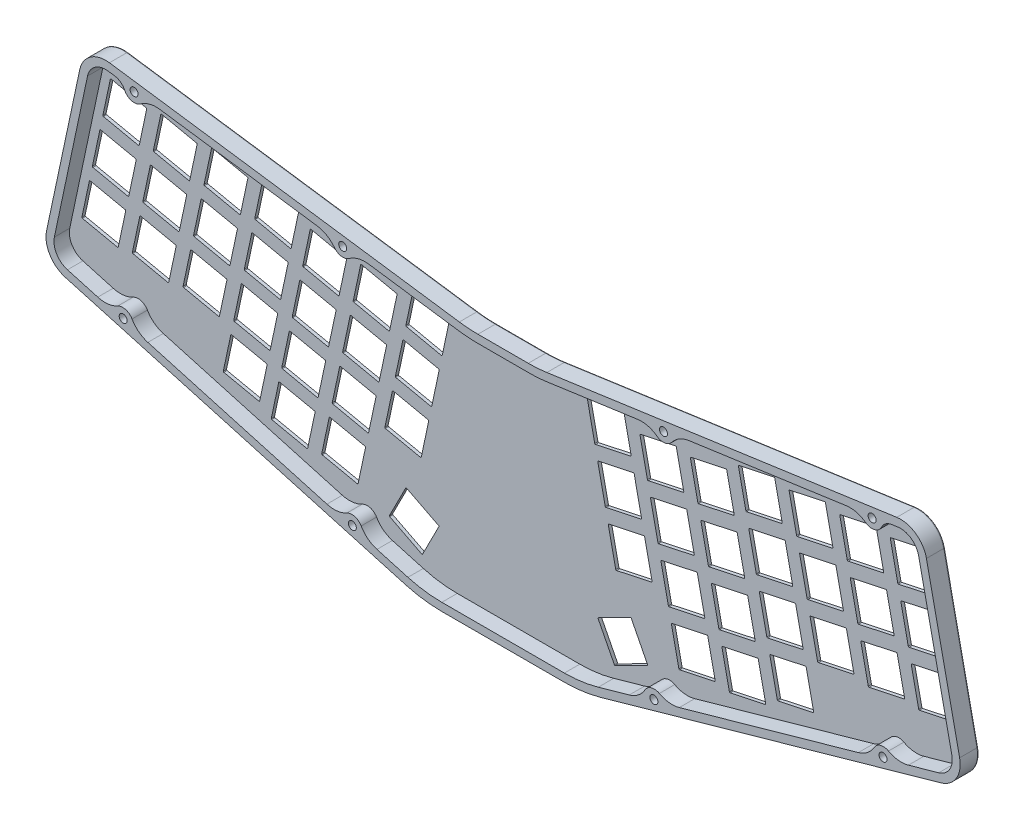
from build123d import *

# Parameters (mm, degrees)
MODEL_R             = 1.5
BOSS_EXTRUDE1_DEPTH = 7
BOSS_EXTRUDE2_DEPTH = 1.2
MODEL_4_R           = 1.5
BOSS_EXTRUDE3_DEPTH = 2
FILLET1_R           = 0.5


with BuildPart() as part:
    # Model → Boss-Extrude1 (new body)
    with BuildSketch(Plane.XY):
        with BuildLine():
            Line((332.060338107, 8.179016053), (325.312640255, 39.924438699))
            Line((325.312640255, 39.924438699), (319.565261174, 66.96373151))
            ThreePointArc((319.565261174, 66.96373151), (315.515297863, 73.079110459), (308.381777137, 74.78584552))
            Line((308.381777137, 74.78584552), (176.614039179, 56.12761726))
            ThreePointArc((176.614039179, 56.12761726), (173.117705991, 55.75738597), (169.603999044, 55.6337718))
            Line((169.603999044, 55.6337718), (150.648829756, 55.6337718))
            ThreePointArc((150.648829756, 55.6337718), (147.135122809, 55.75738597), (143.63878962, 56.12761726))
            Line((143.63878962, 56.12761726), (11.871051663, 74.785845521))
            ThreePointArc((11.871051663, 74.785845521), (4.737530938, 73.07911046), (0.687567627, 66.963731511))
            Line((0.687567627, 66.963731511), (-5.059811455, 39.924438699))
            Line((-5.059811455, 39.924438699), (-11.807509307, 8.179016053))
            ThreePointArc((-11.807509307, 8.179016053), (-10.587273101, 0.932194341), (-4.743504981, -3.523787647))
            Line((-4.743504981, -3.523787647), (47.488623446, -18.272743308))
            Line((47.488623446, -18.272743308), (123.463014033, -39.725878608))
            ThreePointArc((123.463014033, -39.725878608), (130.191863147, -41.134819356), (137.050372447, -41.6074446))
            Line((137.050372447, -41.6074446), (160.1264144, -41.6074446))
            Line((160.1264144, -41.6074446), (183.202456353, -41.6074446))
            ThreePointArc((183.202456353, -41.6074446), (190.060965653, -41.134819356), (196.789814767, -39.725878608))
            Line((196.789814767, -39.725878608), (272.764205354, -18.272743308))
            Line((272.764205354, -18.272743308), (324.996333781, -3.523787647))
            ThreePointArc((324.996333781, -3.523787647), (330.840101901, 0.932194341), (332.060338107, 8.179016053))
        make_face()
        with Locations((103.335575354, -30.405568574)):
            Circle(MODEL_R, mode=Mode.SUBTRACT)
        with Locations((17.039281052, -6.037803815)):
            Circle(MODEL_R, mode=Mode.SUBTRACT)
        with Locations((216.917253446, -30.405568574)):
            Circle(MODEL_R, mode=Mode.SUBTRACT)
        with Locations((303.213547748, -6.037803815)):
            Circle(MODEL_R, mode=Mode.SUBTRACT)
        with Locations((21.146353911, 69.937554571)):
            Circle(MODEL_R, mode=Mode.SUBTRACT)
        with Locations((99.718342652, 58.811810716)):
            Circle(MODEL_R, mode=Mode.SUBTRACT)
        with BuildLine():
            Line((316.630818371, 66.339996441), (322.378197452, 39.30070363))
            Line((322.378197452, 39.30070363), (329.125895305, 7.555280983))
            ThreePointArc((329.125895305, 7.555280983), (328.27172996, 2.482505785), (324.181092276, -0.636681606))
            Line((324.181092276, -0.636681606), (312.778670176, -3.85642055))
            ThreePointArc((312.778670176, -3.85642055), (308.939676687, -4.169644175), (305.26707195, -3.008629753))
            ThreePointArc((305.26707195, -3.008629753), (302.26243266, -2.669513434), (299.878929754, -4.530096956))
            ThreePointArc((299.878929754, -4.530096956), (297.356002421, -7.440563881), (293.920172489, -9.18155576))
            Line((293.920172489, -9.18155576), (271.948963849, -15.385637267))
            Line((271.948963849, -15.385637267), (226.482375873, -28.224185309))
            ThreePointArc((226.482375873, -28.224185309), (222.643382385, -28.537408934), (218.970777647, -27.376394512))
            ThreePointArc((218.970777647, -27.376394512), (215.966138357, -27.037278193), (213.582635451, -28.897861715))
            ThreePointArc((213.582635451, -28.897861715), (211.059708119, -31.80832864), (207.623878187, -33.549320519))
            Line((207.623878187, -33.549320519), (195.974573262, -36.838772567))
            ThreePointArc((195.974573262, -36.838772567), (189.649455095, -38.16317687), (183.202456353, -38.6074446))
            Line((183.202456353, -38.6074446), (160.1264144, -38.6074446))
            Line((160.1264144, -38.6074446), (137.050372447, -38.6074446))
            ThreePointArc((137.050372447, -38.6074446), (130.603373705, -38.16317687), (124.278255538, -36.838772567))
            Line((124.278255538, -36.838772567), (112.628950613, -33.549320519))
            ThreePointArc((112.628950613, -33.549320519), (109.193120681, -31.80832864), (106.670193349, -28.897861715))
            ThreePointArc((106.670193349, -28.897861715), (104.286690443, -27.037278193), (101.282051153, -27.376394512))
            ThreePointArc((101.282051153, -27.376394512), (97.609446415, -28.537408934), (93.770452927, -28.224185309))
            Line((93.770452927, -28.224185309), (48.303864951, -15.385637267))
            Line((48.303864951, -15.385637267), (26.332656311, -9.18155576))
            ThreePointArc((26.332656311, -9.18155576), (22.896826379, -7.440563881), (20.373899046, -4.530096956))
            ThreePointArc((20.373899046, -4.530096956), (17.99039614, -2.669513434), (14.98575685, -3.008629753))
            ThreePointArc((14.98575685, -3.008629753), (11.313152113, -4.169644175), (7.474158624, -3.85642055))
            Line((7.474158624, -3.85642055), (-3.928263476, -0.636681606))
            ThreePointArc((-3.928263476, -0.636681606), (-8.01890116, 2.482505785), (-8.873066505, 7.555280983))
            Line((-8.873066505, 7.555280983), (-2.125368652, 39.30070363))
            Line((-2.125368652, 39.30070363), (3.622010429, 66.339996442))
            ThreePointArc((3.622010429, 66.339996442), (6.456984747, 70.620761706), (11.450449255, 71.815476249))
            Line((11.450449255, 71.815476249), (13.807051559, 71.481782855))
            ThreePointArc((13.807051559, 71.481782855), (16.05801748, 70.566743382), (17.611829082, 68.698638909))
            ThreePointArc((17.611829082, 68.698638909), (20.250303311, 66.551050421), (23.587647853, 67.21121251))
            ThreePointArc((23.587647853, 67.21121251), (27.071325394, 68.854371308), (30.917639732, 69.058934404))
            Line((30.917639732, 69.058934404), (90.087257633, 60.680553975))
            ThreePointArc((90.087257633, 60.680553975), (93.725570339, 59.416172428), (96.616102068, 56.870429634))
            ThreePointArc((96.616102068, 56.870429634), (99.227639842, 55.346379898), (102.159636594, 56.085468655))
            ThreePointArc((102.159636594, 56.085468655), (105.643314135, 57.728627453), (109.489628473, 57.933190549))
            Line((109.489628473, 57.933190549), (143.218187212, 53.157247988))
            ThreePointArc((143.218187212, 53.157247988), (146.924300392, 52.76480282), (150.648829756, 52.6337718))
            Line((150.648829756, 52.6337718), (169.603999044, 52.6337718))
            ThreePointArc((169.603999044, 52.6337718), (173.328528408, 52.76480282), (177.034641588, 53.157247988))
            Line((177.034641588, 53.157247988), (210.763200327, 57.933190549))
            ThreePointArc((210.763200327, 57.933190549), (214.609514665, 57.728627453), (218.093192206, 56.085468655))
            ThreePointArc((218.093192206, 56.085468655), (221.025188958, 55.346379898), (223.636726732, 56.870429634))
            ThreePointArc((223.636726732, 56.870429634), (226.52725846, 59.416172428), (230.165571167, 60.680553974))
            Line((230.165571167, 60.680553974), (289.335189068, 69.058934403))
            ThreePointArc((289.335189068, 69.058934403), (293.181503406, 68.854371307), (296.665180948, 67.211212509))
            ThreePointArc((296.665180948, 67.211212509), (300.002525489, 66.55105042), (302.640999718, 68.698638908))
            ThreePointArc((302.640999718, 68.698638908), (304.19481132, 70.566743381), (306.445777241, 71.481782853))
            Line((306.445777241, 71.481782853), (308.802379545, 71.815476247))
            ThreePointArc((308.802379545, 71.815476247), (313.795844053, 70.620761705), (316.630818371, 66.339996441))
        make_face(mode=Mode.SUBTRACT)
        with Locations((220.534486148, 58.811810716)):
            Circle(MODEL_R, mode=Mode.SUBTRACT)
        with Locations((299.10647489, 69.93755457)):
            Circle(MODEL_R, mode=Mode.SUBTRACT)
    extrude(amount=BOSS_EXTRUDE1_DEPTH)

    # Model<3> → Boss-Extrude2 (add)
    with BuildSketch(Plane.XY):
        with BuildLine():
            Line((329.125895305, 7.555280983), (322.378197452, 39.30070363))
            Line((322.378197452, 39.30070363), (316.630818371, 66.339996441))
            ThreePointArc((316.630818371, 66.339996441), (313.795844053, 70.620761705), (308.802379545, 71.815476247))
            Line((308.802379545, 71.815476247), (306.445777241, 71.481782853))
            ThreePointArc((306.445777241, 71.481782853), (304.19481132, 70.566743381), (302.640999718, 68.698638908))
            ThreePointArc((302.640999718, 68.698638908), (300.002525489, 66.55105042), (296.665180948, 67.211212509))
            ThreePointArc((296.665180948, 67.211212509), (293.181503406, 68.854371307), (289.335189068, 69.058934403))
            Line((289.335189068, 69.058934403), (230.165571167, 60.680553974))
            ThreePointArc((230.165571167, 60.680553974), (226.52725846, 59.416172428), (223.636726732, 56.870429634))
            ThreePointArc((223.636726732, 56.870429634), (221.025188958, 55.346379898), (218.093192206, 56.085468655))
            ThreePointArc((218.093192206, 56.085468655), (214.609514665, 57.728627453), (210.763200327, 57.933190549))
            Line((210.763200327, 57.933190549), (177.034641588, 53.157247988))
            ThreePointArc((177.034641588, 53.157247988), (173.328528408, 52.76480282), (169.603999044, 52.6337718))
            Line((169.603999044, 52.6337718), (150.648829756, 52.6337718))
            ThreePointArc((150.648829756, 52.6337718), (146.924300392, 52.76480282), (143.218187212, 53.157247988))
            Line((143.218187212, 53.157247988), (109.489628473, 57.933190549))
            ThreePointArc((109.489628473, 57.933190549), (105.643314135, 57.728627453), (102.159636594, 56.085468655))
            ThreePointArc((102.159636594, 56.085468655), (99.227639842, 55.346379898), (96.616102068, 56.870429634))
            ThreePointArc((96.616102068, 56.870429634), (93.725570339, 59.416172428), (90.087257633, 60.680553975))
            Line((90.087257633, 60.680553975), (30.917639732, 69.058934404))
            ThreePointArc((30.917639732, 69.058934404), (27.071325394, 68.854371308), (23.587647853, 67.21121251))
            ThreePointArc((23.587647853, 67.21121251), (20.250303311, 66.551050421), (17.611829082, 68.698638909))
            ThreePointArc((17.611829082, 68.698638909), (16.05801748, 70.566743382), (13.807051559, 71.481782855))
            Line((13.807051559, 71.481782855), (11.450449255, 71.815476249))
            ThreePointArc((11.450449255, 71.815476249), (6.456984747, 70.620761706), (3.622010429, 66.339996442))
            Line((3.622010429, 66.339996442), (-2.125368652, 39.30070363))
            Line((-2.125368652, 39.30070363), (-8.873066505, 7.555280983))
            ThreePointArc((-8.873066505, 7.555280983), (-8.01890116, 2.482505785), (-3.928263476, -0.636681606))
            Line((-3.928263476, -0.636681606), (7.474158624, -3.85642055))
            ThreePointArc((7.474158624, -3.85642055), (11.313152113, -4.169644175), (14.98575685, -3.008629753))
            ThreePointArc((14.98575685, -3.008629753), (17.99039614, -2.669513434), (20.373899046, -4.530096956))
            ThreePointArc((20.373899046, -4.530096956), (22.896826379, -7.440563881), (26.332656311, -9.18155576))
            Line((26.332656311, -9.18155576), (48.303864951, -15.385637267))
            Line((48.303864951, -15.385637267), (93.770452927, -28.224185309))
            ThreePointArc((93.770452927, -28.224185309), (97.609446415, -28.537408934), (101.282051153, -27.376394512))
            ThreePointArc((101.282051153, -27.376394512), (104.286690443, -27.037278193), (106.670193349, -28.897861715))
            ThreePointArc((106.670193349, -28.897861715), (109.193120681, -31.80832864), (112.628950613, -33.549320519))
            Line((112.628950613, -33.549320519), (124.278255538, -36.838772567))
            ThreePointArc((124.278255538, -36.838772567), (130.603373705, -38.16317687), (137.050372447, -38.6074446))
            Line((137.050372447, -38.6074446), (160.1264144, -38.6074446))
            Line((160.1264144, -38.6074446), (183.202456353, -38.6074446))
            ThreePointArc((183.202456353, -38.6074446), (189.649455095, -38.16317687), (195.974573262, -36.838772567))
            Line((195.974573262, -36.838772567), (207.623878187, -33.549320519))
            ThreePointArc((207.623878187, -33.549320519), (211.059708119, -31.80832864), (213.582635451, -28.897861715))
            ThreePointArc((213.582635451, -28.897861715), (215.966138357, -27.037278193), (218.970777647, -27.376394512))
            ThreePointArc((218.970777647, -27.376394512), (222.643382385, -28.537408934), (226.482375873, -28.224185309))
            Line((226.482375873, -28.224185309), (271.948963849, -15.385637267))
            Line((271.948963849, -15.385637267), (293.920172489, -9.18155576))
            ThreePointArc((293.920172489, -9.18155576), (297.356002421, -7.440563881), (299.878929754, -4.530096956))
            ThreePointArc((299.878929754, -4.530096956), (302.26243266, -2.669513434), (305.26707195, -3.008629753))
            ThreePointArc((305.26707195, -3.008629753), (308.939676687, -4.169644175), (312.778670176, -3.85642055))
            Line((312.778670176, -3.85642055), (324.181092276, -0.636681606))
            ThreePointArc((324.181092276, -0.636681606), (328.27172996, 2.482505785), (329.125895305, 7.555280983))
        make_face()
        with BuildLine():
            ThreePointArc((86.217569965, -18.8372805), (86.059880245, -18.728903359), (86.025010987, -18.540765678))
            Line((86.025010987, -18.540765678), (88.8318188, -5.335773065))
            ThreePointArc((88.8318188, -5.335773065), (88.940195941, -5.178083345), (89.128333622, -5.143214087))
            Line((89.128333622, -5.143214087), (102.333326235, -7.9500219))
            ThreePointArc((102.333326235, -7.9500219), (102.491015955, -8.058399041), (102.525885213, -8.246536722))
            Line((102.525885213, -8.246536722), (99.7190774, -21.451529335))
            ThreePointArc((99.7190774, -21.451529335), (99.610700259, -21.609219055), (99.422562578, -21.644088313))
            Line((99.422562578, -21.644088313), (86.217569965, -18.8372805))
        make_face(mode=Mode.SUBTRACT)
        with BuildLine():
            ThreePointArc((124.004543925, -32.319996546), (123.859046543, -32.444263051), (123.668294669, -32.429250553))
            Line((123.668294669, -32.429250553), (117.65400063, -29.364814683))
            Line((117.65400063, -29.364814683), (111.639706589, -26.300378813))
            ThreePointArc((111.639706589, -26.300378813), (111.515440085, -26.154881431), (111.530452582, -25.964129558))
            Line((111.530452582, -25.964129558), (117.659324282, -13.935541458))
            ThreePointArc((117.659324282, -13.935541458), (117.804821665, -13.811274953), (117.995573538, -13.826287451))
            Line((117.995573538, -13.826287451), (130.024161618, -19.955159191))
            ThreePointArc((130.024161618, -19.955159191), (130.148428123, -20.100656573), (130.133415625, -20.291408446))
            Line((130.133415625, -20.291408446), (124.004543925, -32.319996546))
        make_face(mode=Mode.SUBTRACT)
        with BuildLine():
            ThreePointArc((49.151916965, -10.4475625), (48.994227245, -10.339185359), (48.959357987, -10.151047678))
            Line((48.959357987, -10.151047678), (51.7661658, 3.053944935))
            ThreePointArc((51.7661658, 3.053944935), (51.874542941, 3.211634655), (52.062680622, 3.246503913))
            Line((52.062680622, 3.246503913), (65.267673235, 0.4396961))
            ThreePointArc((65.267673235, 0.4396961), (65.425362955, 0.331318959), (65.460232213, 0.143181278))
            Line((65.460232213, 0.143181278), (62.6534244, -13.061811335))
            ThreePointArc((62.6534244, -13.061811335), (62.545047259, -13.219501055), (62.356909578, -13.254370313))
            Line((62.356909578, -13.254370313), (49.151916965, -10.4475625))
        make_face(mode=Mode.SUBTRACT)
        with BuildLine():
            ThreePointArc((14.893071715, 11.1471482), (14.735381995, 11.255525341), (14.700512737, 11.443663022))
            Line((14.700512737, 11.443663022), (17.50732055, 24.648655635))
            ThreePointArc((17.50732055, 24.648655635), (17.615697691, 24.806345355), (17.803835372, 24.841214613))
            Line((17.803835372, 24.841214613), (31.008827985, 22.0344068))
            ThreePointArc((31.008827985, 22.0344068), (31.166517705, 21.926029659), (31.201386963, 21.737891978))
            Line((31.201386963, 21.737891978), (28.39457915, 8.532899365))
            ThreePointArc((28.39457915, 8.532899365), (28.286202009, 8.375209645), (28.098064328, 8.340340387))
            Line((28.098064328, 8.340340387), (14.893071715, 11.1471482))
        make_face(mode=Mode.SUBTRACT)
        with BuildLine():
            ThreePointArc((33.997655415, 9.6421951), (33.839965695, 9.750572241), (33.805096437, 9.938709922))
            Line((33.805096437, 9.938709922), (36.61190425, 23.143702535))
            ThreePointArc((36.61190425, 23.143702535), (36.720281391, 23.301392255), (36.908419072, 23.336261513))
            Line((36.908419072, 23.336261513), (50.113411685, 20.5294537))
            ThreePointArc((50.113411685, 20.5294537), (50.271101405, 20.421076559), (50.305970663, 20.232938878))
            Line((50.305970663, 20.232938878), (47.49916285, 7.027946265))
            ThreePointArc((47.49916285, 7.027946265), (47.390785709, 6.870256545), (47.202648028, 6.835387287))
            Line((47.202648028, 6.835387287), (33.997655415, 9.6421951))
        make_face(mode=Mode.SUBTRACT)
        with BuildLine():
            ThreePointArc((53.102239015, 8.137242), (52.944549295, 8.245619141), (52.909680037, 8.433756822))
            Line((52.909680037, 8.433756822), (55.71648785, 21.638749435))
            ThreePointArc((55.71648785, 21.638749435), (55.824864991, 21.796439155), (56.013002672, 21.831308413))
            Line((56.013002672, 21.831308413), (69.217995285, 19.0245006))
            ThreePointArc((69.217995285, 19.0245006), (69.375685005, 18.916123459), (69.410554263, 18.727985778))
            Line((69.410554263, 18.727985778), (66.60374645, 5.522993165))
            ThreePointArc((66.60374645, 5.522993165), (66.495369309, 5.365303445), (66.307231628, 5.330434187))
            Line((66.307231628, 5.330434187), (53.102239015, 8.137242))
        make_face(mode=Mode.SUBTRACT)
        with BuildLine():
            ThreePointArc((67.216942165, -16.8432536), (67.059252445, -16.734876459), (67.024383187, -16.546738778))
            Line((67.024383187, -16.546738778), (69.831191, -3.341746165))
            ThreePointArc((69.831191, -3.341746165), (69.939568141, -3.184056445), (70.127705822, -3.149187187))
            Line((70.127705822, -3.149187187), (83.332698435, -5.955995))
            ThreePointArc((83.332698435, -5.955995), (83.490388155, -6.064372141), (83.525257413, -6.252509822))
            Line((83.525257413, -6.252509822), (80.7184496, -19.457502435))
            ThreePointArc((80.7184496, -19.457502435), (80.610072459, -19.615192155), (80.421934778, -19.650061413))
            Line((80.421934778, -19.650061413), (67.216942165, -16.8432536))
        make_face(mode=Mode.SUBTRACT)
        with BuildLine():
            ThreePointArc((71.167264215, 1.7415508), (71.009574495, 1.849927941), (70.974705237, 2.038065622))
            Line((70.974705237, 2.038065622), (73.78151305, 15.243058235))
            ThreePointArc((73.78151305, 15.243058235), (73.889890191, 15.400747955), (74.078027872, 15.435617213))
            Line((74.078027872, 15.435617213), (87.283020485, 12.6288094))
            ThreePointArc((87.283020485, 12.6288094), (87.440710205, 12.520432259), (87.475579463, 12.332294578))
            Line((87.475579463, 12.332294578), (84.66877165, -0.872698035))
            ThreePointArc((84.66877165, -0.872698035), (84.560394509, -1.030387755), (84.372256828, -1.065257013))
            Line((84.372256828, -1.065257013), (71.167264215, 1.7415508))
        make_face(mode=Mode.SUBTRACT)
        with BuildLine():
            ThreePointArc((90.167892015, -0.2524761), (90.010202295, -0.144098959), (89.975333037, 0.044038722))
            Line((89.975333037, 0.044038722), (92.78214085, 13.249031335))
            ThreePointArc((92.78214085, 13.249031335), (92.890517991, 13.406721055), (93.078655672, 13.441590313))
            Line((93.078655672, 13.441590313), (106.283648285, 10.6347825))
            ThreePointArc((106.283648285, 10.6347825), (106.441338005, 10.526405359), (106.476207263, 10.338267678))
            Line((106.476207263, 10.338267678), (103.66939945, -2.866724935))
            ThreePointArc((103.66939945, -2.866724935), (103.561022309, -3.024414655), (103.372884628, -3.059283913))
            Line((103.372884628, -3.059283913), (90.167892015, -0.2524761))
        make_face(mode=Mode.SUBTRACT)
        with BuildLine():
            ThreePointArc((110.000166615, 1.6660874), (109.842476895, 1.774464541), (109.807607637, 1.962602222))
            Line((109.807607637, 1.962602222), (112.61441545, 15.167594835))
            ThreePointArc((112.61441545, 15.167594835), (112.722792591, 15.325284555), (112.910930272, 15.360153813))
            Line((112.910930272, 15.360153813), (126.115922885, 12.553346))
            ThreePointArc((126.115922885, 12.553346), (126.273612605, 12.444968859), (126.308481863, 12.256831178))
            Line((126.308481863, 12.256831178), (123.50167405, -0.948161435))
            ThreePointArc((123.50167405, -0.948161435), (123.393296909, -1.105851155), (123.205159228, -1.140720413))
            Line((123.205159228, -1.140720413), (110.000166615, 1.6660874))
        make_face(mode=Mode.SUBTRACT)
        with BuildLine():
            Line((202.59882817, -29.364814683), (196.584534131, -32.429250553))
            ThreePointArc((196.584534131, -32.429250553), (196.393782257, -32.444263051), (196.248284875, -32.319996546))
            Line((196.248284875, -32.319996546), (190.119413175, -20.291408446))
            ThreePointArc((190.119413175, -20.291408446), (190.104400677, -20.100656573), (190.228667182, -19.955159191))
            Line((190.228667182, -19.955159191), (202.257255262, -13.826287451))
            ThreePointArc((202.257255262, -13.826287451), (202.448007135, -13.811274953), (202.593504518, -13.935541458))
            Line((202.593504518, -13.935541458), (208.722376218, -25.964129558))
            ThreePointArc((208.722376218, -25.964129558), (208.737388715, -26.154881431), (208.613122211, -26.300378813))
            Line((208.613122211, -26.300378813), (202.59882817, -29.364814683))
        make_face(mode=Mode.SUBTRACT)
        with BuildLine():
            Line((231.42101, -5.335773065), (234.227817813, -18.540765678))
            ThreePointArc((234.227817813, -18.540765678), (234.192948555, -18.728903359), (234.035258835, -18.8372805))
            Line((234.035258835, -18.8372805), (220.830266222, -21.644088313))
            ThreePointArc((220.830266222, -21.644088313), (220.642128541, -21.609219055), (220.5337514, -21.451529335))
            Line((220.5337514, -21.451529335), (217.726943587, -8.246536722))
            ThreePointArc((217.726943587, -8.246536722), (217.761812845, -8.058399041), (217.919502565, -7.9500219))
            Line((217.919502565, -7.9500219), (231.124495178, -5.143214087))
            ThreePointArc((231.124495178, -5.143214087), (231.312632859, -5.178083345), (231.42101, -5.335773065))
        make_face(mode=Mode.SUBTRACT)
        with BuildLine():
            Line((250.4216378, -3.341746165), (253.228445613, -16.546738778))
            ThreePointArc((253.228445613, -16.546738778), (253.193576355, -16.734876459), (253.035886635, -16.8432536))
            Line((253.035886635, -16.8432536), (239.830894022, -19.650061413))
            ThreePointArc((239.830894022, -19.650061413), (239.642756341, -19.615192155), (239.5343792, -19.457502435))
            Line((239.5343792, -19.457502435), (236.727571387, -6.252509822))
            ThreePointArc((236.727571387, -6.252509822), (236.762440645, -6.064372141), (236.920130365, -5.955995))
            Line((236.920130365, -5.955995), (250.125122978, -3.149187187))
            ThreePointArc((250.125122978, -3.149187187), (250.313260659, -3.184056445), (250.4216378, -3.341746165))
        make_face(mode=Mode.SUBTRACT)
        with BuildLine():
            Line((207.63841335, 15.167594835), (210.445221163, 1.962602222))
            ThreePointArc((210.445221163, 1.962602222), (210.410351905, 1.774464541), (210.252662185, 1.6660874))
            Line((210.252662185, 1.6660874), (197.047669572, -1.140720413))
            ThreePointArc((197.047669572, -1.140720413), (196.859531891, -1.105851155), (196.75115475, -0.948161435))
            Line((196.75115475, -0.948161435), (193.944346937, 12.256831178))
            ThreePointArc((193.944346937, 12.256831178), (193.979216195, 12.444968859), (194.136905915, 12.553346))
            Line((194.136905915, 12.553346), (207.341898528, 15.360153813))
            ThreePointArc((207.341898528, 15.360153813), (207.530036209, 15.325284555), (207.63841335, 15.167594835))
        make_face(mode=Mode.SUBTRACT)
        with BuildLine():
            Line((227.47068795, 13.249031335), (230.277495763, 0.044038722))
            ThreePointArc((230.277495763, 0.044038722), (230.242626505, -0.144098959), (230.084936785, -0.2524761))
            Line((230.084936785, -0.2524761), (216.879944172, -3.059283913))
            ThreePointArc((216.879944172, -3.059283913), (216.691806491, -3.024414655), (216.58342935, -2.866724935))
            Line((216.58342935, -2.866724935), (213.776621537, 10.338267678))
            ThreePointArc((213.776621537, 10.338267678), (213.811490795, 10.526405359), (213.969180515, 10.6347825))
            Line((213.969180515, 10.6347825), (227.174173128, 13.441590313))
            ThreePointArc((227.174173128, 13.441590313), (227.362310809, 13.406721055), (227.47068795, 13.249031335))
        make_face(mode=Mode.SUBTRACT)
        with BuildLine():
            Line((246.47131575, 15.243058235), (249.278123563, 2.038065622))
            ThreePointArc((249.278123563, 2.038065622), (249.243254305, 1.849927941), (249.085564585, 1.7415508))
            Line((249.085564585, 1.7415508), (235.880571972, -1.065257013))
            ThreePointArc((235.880571972, -1.065257013), (235.692434291, -1.030387755), (235.58405715, -0.872698035))
            Line((235.58405715, -0.872698035), (232.777249337, 12.332294578))
            ThreePointArc((232.777249337, 12.332294578), (232.812118595, 12.520432259), (232.969808315, 12.6288094))
            Line((232.969808315, 12.6288094), (246.174800928, 15.435617213))
            ThreePointArc((246.174800928, 15.435617213), (246.362938609, 15.400747955), (246.47131575, 15.243058235))
        make_face(mode=Mode.SUBTRACT)
        with BuildLine():
            Line((268.486663, 3.053944935), (271.293470813, -10.151047678))
            ThreePointArc((271.293470813, -10.151047678), (271.258601555, -10.339185359), (271.100911835, -10.4475625))
            Line((271.100911835, -10.4475625), (257.895919222, -13.254370313))
            ThreePointArc((257.895919222, -13.254370313), (257.707781541, -13.219501055), (257.5994044, -13.061811335))
            Line((257.5994044, -13.061811335), (254.792596587, 0.143181278))
            ThreePointArc((254.792596587, 0.143181278), (254.827465845, 0.331318959), (254.985155565, 0.4396961))
            Line((254.985155565, 0.4396961), (268.190148178, 3.246503913))
            ThreePointArc((268.190148178, 3.246503913), (268.378285859, 3.211634655), (268.486663, 3.053944935))
        make_face(mode=Mode.SUBTRACT)
        with BuildLine():
            Line((264.53634095, 21.638749435), (267.343148763, 8.433756822))
            ThreePointArc((267.343148763, 8.433756822), (267.308279505, 8.245619141), (267.150589785, 8.137242))
            Line((267.150589785, 8.137242), (253.945597172, 5.330434187))
            ThreePointArc((253.945597172, 5.330434187), (253.757459491, 5.365303445), (253.64908235, 5.522993165))
            Line((253.64908235, 5.522993165), (250.842274537, 18.727985778))
            ThreePointArc((250.842274537, 18.727985778), (250.877143795, 18.916123459), (251.034833515, 19.0245006))
            Line((251.034833515, 19.0245006), (264.239826128, 21.831308413))
            ThreePointArc((264.239826128, 21.831308413), (264.427963809, 21.796439155), (264.53634095, 21.638749435))
        make_face(mode=Mode.SUBTRACT)
        with BuildLine():
            Line((283.64092455, 23.143702535), (286.447732363, 9.938709922))
            ThreePointArc((286.447732363, 9.938709922), (286.412863105, 9.750572241), (286.255173385, 9.6421951))
            Line((286.255173385, 9.6421951), (273.050180772, 6.835387287))
            ThreePointArc((273.050180772, 6.835387287), (272.862043091, 6.870256545), (272.75366595, 7.027946265))
            Line((272.75366595, 7.027946265), (269.946858137, 20.232938878))
            ThreePointArc((269.946858137, 20.232938878), (269.981727395, 20.421076559), (270.139417115, 20.5294537))
            Line((270.139417115, 20.5294537), (283.344409728, 23.336261513))
            ThreePointArc((283.344409728, 23.336261513), (283.532547409, 23.301392255), (283.64092455, 23.143702535))
        make_face(mode=Mode.SUBTRACT)
        with BuildLine():
            Line((302.74550825, 24.648655635), (305.552316063, 11.443663022))
            ThreePointArc((305.552316063, 11.443663022), (305.517446805, 11.255525341), (305.359757085, 11.1471482))
            Line((305.359757085, 11.1471482), (292.154764472, 8.340340387))
            ThreePointArc((292.154764472, 8.340340387), (291.966626791, 8.375209645), (291.85824965, 8.532899365))
            Line((291.85824965, 8.532899365), (289.051441837, 21.737891978))
            ThreePointArc((289.051441837, 21.737891978), (289.086311095, 21.926029659), (289.244000815, 22.0344068))
            Line((289.244000815, 22.0344068), (302.448993428, 24.841214613))
            ThreePointArc((302.448993428, 24.841214613), (302.637131109, 24.806345355), (302.74550825, 24.648655635))
        make_face(mode=Mode.SUBTRACT)
        with BuildLine():
            ThreePointArc((-4.107556035, 13.1411751), (-4.265245755, 13.249552241), (-4.300115013, 13.437689922))
            Line((-4.300115013, 13.437689922), (-1.4933072, 26.642682535))
            ThreePointArc((-1.4933072, 26.642682535), (-1.384930059, 26.800372255), (-1.196792378, 26.835241513))
            Line((-1.196792378, 26.835241513), (12.008200235, 24.0284337))
            ThreePointArc((12.008200235, 24.0284337), (12.165889955, 23.920056559), (12.200759213, 23.731918878))
            Line((12.200759213, 23.731918878), (9.3939514, 10.526926265))
            ThreePointArc((9.3939514, 10.526926265), (9.285574259, 10.369236545), (9.097436578, 10.334367287))
            Line((9.097436578, 10.334367287), (-4.107556035, 13.1411751))
        make_face(mode=Mode.SUBTRACT)
        with BuildLine():
            ThreePointArc((-0.157233835, 31.7259795), (-0.314923555, 31.834356641), (-0.349792813, 32.022494322))
            Line((-0.349792813, 32.022494322), (2.457015, 45.227486935))
            ThreePointArc((2.457015, 45.227486935), (2.565392141, 45.385176655), (2.753529822, 45.420045913))
            Line((2.753529822, 45.420045913), (15.958522435, 42.6132381))
            ThreePointArc((15.958522435, 42.6132381), (16.116212155, 42.504860959), (16.151081413, 42.316723278))
            Line((16.151081413, 42.316723278), (13.3442736, 29.111730665))
            ThreePointArc((13.3442736, 29.111730665), (13.235896459, 28.954040945), (13.047758778, 28.919171687))
            Line((13.047758778, 28.919171687), (-0.157233835, 31.7259795))
        make_face(mode=Mode.SUBTRACT)
        with BuildLine():
            ThreePointArc((18.843393915, 29.7319526), (18.685704195, 29.840329741), (18.650834937, 30.028467422))
            Line((18.650834937, 30.028467422), (21.45764275, 43.233460035))
            ThreePointArc((21.45764275, 43.233460035), (21.566019891, 43.391149755), (21.754157572, 43.426019013))
            Line((21.754157572, 43.426019013), (34.959150185, 40.6192112))
            ThreePointArc((34.959150185, 40.6192112), (35.116839905, 40.510834059), (35.151709163, 40.322696378))
            Line((35.151709163, 40.322696378), (32.34490135, 27.117703765))
            ThreePointArc((32.34490135, 27.117703765), (32.236524209, 26.960014045), (32.048386528, 26.925144787))
            Line((32.048386528, 26.925144787), (18.843393915, 29.7319526))
        make_face(mode=Mode.SUBTRACT)
        with BuildLine():
            ThreePointArc((37.947977615, 28.2269995), (37.790287895, 28.335376641), (37.755418637, 28.523514322))
            Line((37.755418637, 28.523514322), (40.56222645, 41.728506935))
            ThreePointArc((40.56222645, 41.728506935), (40.670603591, 41.886196655), (40.858741272, 41.921065913))
            Line((40.858741272, 41.921065913), (54.063733885, 39.1142581))
            ThreePointArc((54.063733885, 39.1142581), (54.221423605, 39.005880959), (54.256292863, 38.817743278))
            Line((54.256292863, 38.817743278), (51.44948505, 25.612750665))
            ThreePointArc((51.44948505, 25.612750665), (51.341107909, 25.455060945), (51.152970228, 25.420191687))
            Line((51.152970228, 25.420191687), (37.947977615, 28.2269995))
        make_face(mode=Mode.SUBTRACT)
        with BuildLine():
            ThreePointArc((57.052561215, 26.7220464), (56.894871495, 26.830423541), (56.860002237, 27.018561222))
            Line((56.860002237, 27.018561222), (59.66681005, 40.223553835))
            ThreePointArc((59.66681005, 40.223553835), (59.775187191, 40.381243555), (59.963324872, 40.416112813))
            Line((59.963324872, 40.416112813), (73.168317485, 37.609305))
            ThreePointArc((73.168317485, 37.609305), (73.326007205, 37.500927859), (73.360876463, 37.312790178))
            Line((73.360876463, 37.312790178), (70.55406865, 24.107797565))
            ThreePointArc((70.55406865, 24.107797565), (70.445691509, 23.950107845), (70.257553828, 23.915238587))
            Line((70.257553828, 23.915238587), (57.052561215, 26.7220464))
        make_face(mode=Mode.SUBTRACT)
        with BuildLine():
            ThreePointArc((94.118214215, 18.3323283), (93.960524495, 18.440705441), (93.925655237, 18.628843122))
            Line((93.925655237, 18.628843122), (96.73246305, 31.833835735))
            ThreePointArc((96.73246305, 31.833835735), (96.840840191, 31.991525455), (97.028977872, 32.026394713))
            Line((97.028977872, 32.026394713), (110.233970485, 29.2195869))
            ThreePointArc((110.233970485, 29.2195869), (110.391660205, 29.111209759), (110.426529463, 28.923072078))
            Line((110.426529463, 28.923072078), (107.61972165, 15.718079465))
            ThreePointArc((107.61972165, 15.718079465), (107.511344509, 15.560389745), (107.323206828, 15.525520487))
            Line((107.323206828, 15.525520487), (94.118214215, 18.3323283))
        make_face(mode=Mode.SUBTRACT)
        with BuildLine():
            ThreePointArc((75.117586415, 20.3263552), (74.959896695, 20.434732341), (74.925027437, 20.622870022))
            Line((74.925027437, 20.622870022), (77.73183525, 33.827862635))
            ThreePointArc((77.73183525, 33.827862635), (77.840212391, 33.985552355), (78.028350072, 34.020421613))
            Line((78.028350072, 34.020421613), (91.233342685, 31.2136138))
            ThreePointArc((91.233342685, 31.2136138), (91.391032405, 31.105236659), (91.425901663, 30.917098978))
            Line((91.425901663, 30.917098978), (88.61909385, 17.712106365))
            ThreePointArc((88.61909385, 17.712106365), (88.510716709, 17.554416645), (88.322579028, 17.519547387))
            Line((88.322579028, 17.519547387), (75.117586415, 20.3263552))
        make_face(mode=Mode.SUBTRACT)
        with BuildLine():
            ThreePointArc((113.950488815, 20.2508918), (113.792799095, 20.359268941), (113.757929837, 20.547406622))
            Line((113.757929837, 20.547406622), (116.56473765, 33.752399235))
            ThreePointArc((116.56473765, 33.752399235), (116.673114791, 33.910088955), (116.861252472, 33.944958213))
            Line((116.861252472, 33.944958213), (130.066245085, 31.1381504))
            ThreePointArc((130.066245085, 31.1381504), (130.223934805, 31.029773259), (130.258804063, 30.841635578))
            Line((130.258804063, 30.841635578), (127.45199625, 17.636642965))
            ThreePointArc((127.45199625, 17.636642965), (127.343619109, 17.478953245), (127.155481428, 17.444083987))
            Line((127.155481428, 17.444083987), (113.950488815, 20.2508918))
        make_face(mode=Mode.SUBTRACT)
        with BuildLine():
            ThreePointArc((79.067908515, 38.9111596), (78.910218795, 39.019536741), (78.875349537, 39.207674422))
            Line((78.875349537, 39.207674422), (81.68215735, 52.412667035))
            ThreePointArc((81.68215735, 52.412667035), (81.790534491, 52.570356755), (81.978672172, 52.605226013))
            Line((81.978672172, 52.605226013), (95.183664785, 49.7984182))
            ThreePointArc((95.183664785, 49.7984182), (95.341354505, 49.690041059), (95.376223763, 49.501903378))
            Line((95.376223763, 49.501903378), (92.56941595, 36.296910765))
            ThreePointArc((92.56941595, 36.296910765), (92.461038809, 36.139221045), (92.272901128, 36.104351787))
            Line((92.272901128, 36.104351787), (79.067908515, 38.9111596))
        make_face(mode=Mode.SUBTRACT)
        with BuildLine():
            ThreePointArc((98.068536315, 36.9171327), (97.910846595, 37.025509841), (97.875977337, 37.213647522))
            Line((97.875977337, 37.213647522), (100.68278515, 50.418640135))
            ThreePointArc((100.68278515, 50.418640135), (100.791162291, 50.576329855), (100.979299972, 50.611199113))
            Line((100.979299972, 50.611199113), (114.184292585, 47.8043913))
            ThreePointArc((114.184292585, 47.8043913), (114.341982305, 47.696014159), (114.376851563, 47.507876478))
            Line((114.376851563, 47.507876478), (111.57004375, 34.302883865))
            ThreePointArc((111.57004375, 34.302883865), (111.461666609, 34.145194145), (111.273528928, 34.110324887))
            Line((111.273528928, 34.110324887), (98.068536315, 36.9171327))
        make_face(mode=Mode.SUBTRACT)
        with BuildLine():
            ThreePointArc((117.900810915, 38.8356962), (117.743121195, 38.944073341), (117.708251937, 39.132211022))
            Line((117.708251937, 39.132211022), (120.51505975, 52.337203635))
            ThreePointArc((120.51505975, 52.337203635), (120.623436891, 52.494893355), (120.811574572, 52.529762613))
            Line((120.811574572, 52.529762613), (134.016567185, 49.7229548))
            ThreePointArc((134.016567185, 49.7229548), (134.174256905, 49.614577659), (134.209126163, 49.426439978))
            Line((134.209126163, 49.426439978), (131.40231835, 36.221447365))
            ThreePointArc((131.40231835, 36.221447365), (131.293941209, 36.063757645), (131.105803528, 36.028888387))
            Line((131.105803528, 36.028888387), (117.900810915, 38.8356962))
        make_face(mode=Mode.SUBTRACT)
        with BuildLine():
            ThreePointArc((3.793088265, 50.3107839), (3.635398545, 50.419161041), (3.600529287, 50.607298722))
            Line((3.600529287, 50.607298722), (6.4073371, 63.812291335))
            ThreePointArc((6.4073371, 63.812291335), (6.515714241, 63.969981055), (6.703851922, 64.004850313))
            Line((6.703851922, 64.004850313), (19.908844535, 61.1980425))
            ThreePointArc((19.908844535, 61.1980425), (20.066534255, 61.089665359), (20.101403513, 60.901527678))
            Line((20.101403513, 60.901527678), (17.2945957, 47.696535065))
            ThreePointArc((17.2945957, 47.696535065), (17.186218559, 47.538845345), (16.998080878, 47.503976087))
            Line((16.998080878, 47.503976087), (3.793088265, 50.3107839))
        make_face(mode=Mode.SUBTRACT)
        with BuildLine():
            ThreePointArc((22.793716015, 48.316757), (22.636026295, 48.425134141), (22.601157037, 48.613271822))
            Line((22.601157037, 48.613271822), (25.40796485, 61.818264435))
            ThreePointArc((25.40796485, 61.818264435), (25.516341991, 61.975954155), (25.704479672, 62.010823413))
            Line((25.704479672, 62.010823413), (38.909472285, 59.2040156))
            ThreePointArc((38.909472285, 59.2040156), (39.067162005, 59.095638459), (39.102031263, 58.907500778))
            Line((39.102031263, 58.907500778), (36.29522345, 45.702508165))
            ThreePointArc((36.29522345, 45.702508165), (36.186846309, 45.544818445), (35.998708628, 45.509949187))
            Line((35.998708628, 45.509949187), (22.793716015, 48.316757))
        make_face(mode=Mode.SUBTRACT)
        with BuildLine():
            ThreePointArc((41.898299715, 46.8118039), (41.740609995, 46.920181041), (41.705740737, 47.108318722))
            Line((41.705740737, 47.108318722), (44.51254855, 60.313311335))
            ThreePointArc((44.51254855, 60.313311335), (44.620925691, 60.471001055), (44.809063372, 60.505870313))
            Line((44.809063372, 60.505870313), (58.014055985, 57.6990625))
            ThreePointArc((58.014055985, 57.6990625), (58.171745705, 57.590685359), (58.206614963, 57.402547678))
            Line((58.206614963, 57.402547678), (55.39980715, 44.197555065))
            ThreePointArc((55.39980715, 44.197555065), (55.291430009, 44.039865345), (55.103292328, 44.004996087))
            Line((55.103292328, 44.004996087), (41.898299715, 46.8118039))
        make_face(mode=Mode.SUBTRACT)
        with BuildLine():
            ThreePointArc((61.002883315, 45.3068508), (60.845193595, 45.415227941), (60.810324337, 45.603365622))
            Line((60.810324337, 45.603365622), (63.61713215, 58.808358235))
            ThreePointArc((63.61713215, 58.808358235), (63.725509291, 58.966047955), (63.913646972, 59.000917213))
            Line((63.913646972, 59.000917213), (77.118639585, 56.1941094))
            ThreePointArc((77.118639585, 56.1941094), (77.276329305, 56.085732259), (77.311198563, 55.897594578))
            Line((77.311198563, 55.897594578), (74.50439075, 42.692601965))
            ThreePointArc((74.50439075, 42.692601965), (74.396013609, 42.534912245), (74.207875928, 42.500042987))
            Line((74.207875928, 42.500042987), (61.002883315, 45.3068508))
        make_face(mode=Mode.SUBTRACT)
        with BuildLine():
            Line((203.68809115, 33.752399235), (206.494898963, 20.547406622))
            ThreePointArc((206.494898963, 20.547406622), (206.460029705, 20.359268941), (206.302339985, 20.2508918))
            Line((206.302339985, 20.2508918), (193.097347372, 17.444083987))
            ThreePointArc((193.097347372, 17.444083987), (192.909209691, 17.478953245), (192.80083255, 17.636642965))
            Line((192.80083255, 17.636642965), (189.994024737, 30.841635578))
            ThreePointArc((189.994024737, 30.841635578), (190.028893995, 31.029773259), (190.186583715, 31.1381504))
            Line((190.186583715, 31.1381504), (203.391576328, 33.944958213))
            ThreePointArc((203.391576328, 33.944958213), (203.579714009, 33.910088955), (203.68809115, 33.752399235))
        make_face(mode=Mode.SUBTRACT)
        with BuildLine():
            Line((223.52036575, 31.833835735), (226.327173563, 18.628843122))
            ThreePointArc((226.327173563, 18.628843122), (226.292304305, 18.440705441), (226.134614585, 18.3323283))
            Line((226.134614585, 18.3323283), (212.929621972, 15.525520487))
            ThreePointArc((212.929621972, 15.525520487), (212.741484291, 15.560389745), (212.63310715, 15.718079465))
            Line((212.63310715, 15.718079465), (209.826299337, 28.923072078))
            ThreePointArc((209.826299337, 28.923072078), (209.861168595, 29.111209759), (210.018858315, 29.2195869))
            Line((210.018858315, 29.2195869), (223.223850928, 32.026394713))
            ThreePointArc((223.223850928, 32.026394713), (223.411988609, 31.991525455), (223.52036575, 31.833835735))
        make_face(mode=Mode.SUBTRACT)
        with BuildLine():
            Line((242.52099355, 33.827862635), (245.327801363, 20.622870022))
            ThreePointArc((245.327801363, 20.622870022), (245.292932105, 20.434732341), (245.135242385, 20.3263552))
            Line((245.135242385, 20.3263552), (231.930249772, 17.519547387))
            ThreePointArc((231.930249772, 17.519547387), (231.742112091, 17.554416645), (231.63373495, 17.712106365))
            Line((231.63373495, 17.712106365), (228.826927137, 30.917098978))
            ThreePointArc((228.826927137, 30.917098978), (228.861796395, 31.105236659), (229.019486115, 31.2136138))
            Line((229.019486115, 31.2136138), (242.224478728, 34.020421613))
            ThreePointArc((242.224478728, 34.020421613), (242.412616409, 33.985552355), (242.52099355, 33.827862635))
        make_face(mode=Mode.SUBTRACT)
        with BuildLine():
            Line((199.73776905, 52.337203635), (202.544576863, 39.132211022))
            ThreePointArc((202.544576863, 39.132211022), (202.509707605, 38.944073341), (202.352017885, 38.8356962))
            Line((202.352017885, 38.8356962), (189.147025272, 36.028888387))
            ThreePointArc((189.147025272, 36.028888387), (188.958887591, 36.063757645), (188.85051045, 36.221447365))
            Line((188.85051045, 36.221447365), (186.043702637, 49.426439978))
            ThreePointArc((186.043702637, 49.426439978), (186.078571895, 49.614577659), (186.236261615, 49.7229548))
            Line((186.236261615, 49.7229548), (199.441254228, 52.529762613))
            ThreePointArc((199.441254228, 52.529762613), (199.629391909, 52.494893355), (199.73776905, 52.337203635))
        make_face(mode=Mode.SUBTRACT)
        with BuildLine():
            Line((219.57004365, 50.418640135), (222.376851463, 37.213647522))
            ThreePointArc((222.376851463, 37.213647522), (222.341982205, 37.025509841), (222.184292485, 36.9171327))
            Line((222.184292485, 36.9171327), (208.979299872, 34.110324887))
            ThreePointArc((208.979299872, 34.110324887), (208.791162191, 34.145194145), (208.68278505, 34.302883865))
            Line((208.68278505, 34.302883865), (205.875977237, 47.507876478))
            ThreePointArc((205.875977237, 47.507876478), (205.910846495, 47.696014159), (206.068536215, 47.8043913))
            Line((206.068536215, 47.8043913), (219.273528828, 50.611199113))
            ThreePointArc((219.273528828, 50.611199113), (219.461666509, 50.576329855), (219.57004365, 50.418640135))
        make_face(mode=Mode.SUBTRACT)
        with BuildLine():
            Line((238.57067145, 52.412667035), (241.377479263, 39.207674422))
            ThreePointArc((241.377479263, 39.207674422), (241.342610005, 39.019536741), (241.184920285, 38.9111596))
            Line((241.184920285, 38.9111596), (227.979927672, 36.104351787))
            ThreePointArc((227.979927672, 36.104351787), (227.791789991, 36.139221045), (227.68341285, 36.296910765))
            Line((227.68341285, 36.296910765), (224.876605037, 49.501903378))
            ThreePointArc((224.876605037, 49.501903378), (224.911474295, 49.690041059), (225.069164015, 49.7984182))
            Line((225.069164015, 49.7984182), (238.274156628, 52.605226013))
            ThreePointArc((238.274156628, 52.605226013), (238.462294309, 52.570356755), (238.57067145, 52.412667035))
        make_face(mode=Mode.SUBTRACT)
        with BuildLine():
            Line((321.746136, 26.642682535), (324.552943813, 13.437689922))
            ThreePointArc((324.552943813, 13.437689922), (324.518074555, 13.249552241), (324.360384835, 13.1411751))
            Line((324.360384835, 13.1411751), (311.155392222, 10.334367287))
            ThreePointArc((311.155392222, 10.334367287), (310.967254541, 10.369236545), (310.8588774, 10.526926265))
            Line((310.8588774, 10.526926265), (308.052069587, 23.731918878))
            ThreePointArc((308.052069587, 23.731918878), (308.086938845, 23.920056559), (308.244628565, 24.0284337))
            Line((308.244628565, 24.0284337), (321.449621178, 26.835241513))
            ThreePointArc((321.449621178, 26.835241513), (321.637758859, 26.800372255), (321.746136, 26.642682535))
        make_face(mode=Mode.SUBTRACT)
        with BuildLine():
            Line((260.58601875, 40.223553835), (263.392826563, 27.018561222))
            ThreePointArc((263.392826563, 27.018561222), (263.357957305, 26.830423541), (263.200267585, 26.7220464))
            Line((263.200267585, 26.7220464), (249.995274972, 23.915238587))
            ThreePointArc((249.995274972, 23.915238587), (249.807137291, 23.950107845), (249.69876015, 24.107797565))
            Line((249.69876015, 24.107797565), (246.891952337, 37.312790178))
            ThreePointArc((246.891952337, 37.312790178), (246.926821595, 37.500927859), (247.084511315, 37.609305))
            Line((247.084511315, 37.609305), (260.289503928, 40.416112813))
            ThreePointArc((260.289503928, 40.416112813), (260.477641609, 40.381243555), (260.58601875, 40.223553835))
        make_face(mode=Mode.SUBTRACT)
        with BuildLine():
            Line((279.69060235, 41.728506935), (282.497410163, 28.523514322))
            ThreePointArc((282.497410163, 28.523514322), (282.462540905, 28.335376641), (282.304851185, 28.2269995))
            Line((282.304851185, 28.2269995), (269.099858572, 25.420191687))
            ThreePointArc((269.099858572, 25.420191687), (268.911720891, 25.455060945), (268.80334375, 25.612750665))
            Line((268.80334375, 25.612750665), (265.996535937, 38.817743278))
            ThreePointArc((265.996535937, 38.817743278), (266.031405195, 39.005880959), (266.189094915, 39.1142581))
            Line((266.189094915, 39.1142581), (279.394087528, 41.921065913))
            ThreePointArc((279.394087528, 41.921065913), (279.582225209, 41.886196655), (279.69060235, 41.728506935))
        make_face(mode=Mode.SUBTRACT)
        with BuildLine():
            Line((298.79518605, 43.233460035), (301.601993863, 30.028467422))
            ThreePointArc((301.601993863, 30.028467422), (301.567124605, 29.840329741), (301.409434885, 29.7319526))
            Line((301.409434885, 29.7319526), (288.204442272, 26.925144787))
            ThreePointArc((288.204442272, 26.925144787), (288.016304591, 26.960014045), (287.90792745, 27.117703765))
            Line((287.90792745, 27.117703765), (285.101119637, 40.322696378))
            ThreePointArc((285.101119637, 40.322696378), (285.135988895, 40.510834059), (285.293678615, 40.6192112))
            Line((285.293678615, 40.6192112), (298.498671228, 43.426019013))
            ThreePointArc((298.498671228, 43.426019013), (298.686808909, 43.391149755), (298.79518605, 43.233460035))
        make_face(mode=Mode.SUBTRACT)
        with BuildLine():
            Line((317.7958138, 45.227486935), (320.602621613, 32.022494322))
            ThreePointArc((320.602621613, 32.022494322), (320.567752355, 31.834356641), (320.410062635, 31.7259795))
            Line((320.410062635, 31.7259795), (307.205070022, 28.919171687))
            ThreePointArc((307.205070022, 28.919171687), (307.016932341, 28.954040945), (306.9085552, 29.111730665))
            Line((306.9085552, 29.111730665), (304.101747387, 42.316723278))
            ThreePointArc((304.101747387, 42.316723278), (304.136616645, 42.504860959), (304.294306365, 42.6132381))
            Line((304.294306365, 42.6132381), (317.499298978, 45.420045913))
            ThreePointArc((317.499298978, 45.420045913), (317.687436659, 45.385176655), (317.7958138, 45.227486935))
        make_face(mode=Mode.SUBTRACT)
        with BuildLine():
            Line((256.63569665, 58.808358235), (259.442504463, 45.603365622))
            ThreePointArc((259.442504463, 45.603365622), (259.407635205, 45.415227941), (259.249945485, 45.3068508))
            Line((259.249945485, 45.3068508), (246.044952872, 42.500042987))
            ThreePointArc((246.044952872, 42.500042987), (245.856815191, 42.534912245), (245.74843805, 42.692601965))
            Line((245.74843805, 42.692601965), (242.941630237, 55.897594578))
            ThreePointArc((242.941630237, 55.897594578), (242.976499495, 56.085732259), (243.134189215, 56.1941094))
            Line((243.134189215, 56.1941094), (256.339181828, 59.000917213))
            ThreePointArc((256.339181828, 59.000917213), (256.527319509, 58.966047955), (256.63569665, 58.808358235))
        make_face(mode=Mode.SUBTRACT)
        with BuildLine():
            Line((275.74028025, 60.313311335), (278.547088063, 47.108318722))
            ThreePointArc((278.547088063, 47.108318722), (278.512218805, 46.920181041), (278.354529085, 46.8118039))
            Line((278.354529085, 46.8118039), (265.149536472, 44.004996087))
            ThreePointArc((265.149536472, 44.004996087), (264.961398791, 44.039865345), (264.85302165, 44.197555065))
            Line((264.85302165, 44.197555065), (262.046213837, 57.402547678))
            ThreePointArc((262.046213837, 57.402547678), (262.081083095, 57.590685359), (262.238772815, 57.6990625))
            Line((262.238772815, 57.6990625), (275.443765428, 60.505870313))
            ThreePointArc((275.443765428, 60.505870313), (275.631903109, 60.471001055), (275.74028025, 60.313311335))
        make_face(mode=Mode.SUBTRACT)
        with BuildLine():
            Line((294.84486395, 61.818264435), (297.651671763, 48.613271822))
            ThreePointArc((297.651671763, 48.613271822), (297.616802505, 48.425134141), (297.459112785, 48.316757))
            Line((297.459112785, 48.316757), (284.254120172, 45.509949187))
            ThreePointArc((284.254120172, 45.509949187), (284.065982491, 45.544818445), (283.95760535, 45.702508165))
            Line((283.95760535, 45.702508165), (281.150797537, 58.907500778))
            ThreePointArc((281.150797537, 58.907500778), (281.185666795, 59.095638459), (281.343356515, 59.2040156))
            Line((281.343356515, 59.2040156), (294.548349128, 62.010823413))
            ThreePointArc((294.548349128, 62.010823413), (294.736486809, 61.975954155), (294.84486395, 61.818264435))
        make_face(mode=Mode.SUBTRACT)
        with BuildLine():
            Line((313.8454917, 63.812291335), (316.652299513, 50.607298722))
            ThreePointArc((316.652299513, 50.607298722), (316.617430255, 50.419161041), (316.459740535, 50.3107839))
            Line((316.459740535, 50.3107839), (303.254747922, 47.503976087))
            ThreePointArc((303.254747922, 47.503976087), (303.066610241, 47.538845345), (302.9582331, 47.696535065))
            Line((302.9582331, 47.696535065), (300.151425287, 60.901527678))
            ThreePointArc((300.151425287, 60.901527678), (300.186294545, 61.089665359), (300.343984265, 61.1980425))
            Line((300.343984265, 61.1980425), (313.548976878, 64.004850313))
            ThreePointArc((313.548976878, 64.004850313), (313.737114559, 63.969981055), (313.8454917, 63.812291335))
        make_face(mode=Mode.SUBTRACT)
    extrude(amount=BOSS_EXTRUDE2_DEPTH)

    # Model<4> → Boss-Extrude3 (add)
    with BuildSketch(Plane.XY):
        with Locations((21.146353911, 69.937554571)):
            Circle(MODEL_4_R)
        with Locations((299.10647489, 69.93755457)):
            Circle(MODEL_4_R)
        with Locations((303.213547748, -6.037803815)):
            Circle(MODEL_4_R)
        with Locations((17.039281052, -6.037803815)):
            Circle(MODEL_4_R)
        with Locations((220.534486148, 58.811810716)):
            Circle(MODEL_4_R)
        with Locations((99.718342652, 58.811810716)):
            Circle(MODEL_4_R)
        with Locations((216.917253446, -30.405568574)):
            Circle(MODEL_4_R)
        with Locations((103.335575354, -30.405568574)):
            Circle(MODEL_4_R)
    extrude(amount=BOSS_EXTRUDE3_DEPTH)

    # Fillet1
    fillet1_edges = [part.edges().sort_by_distance(p)[0] for p in [
        (160.1264144, -41.6074446, 0),
    ]]
    fillet(fillet1_edges, radius=FILLET1_R)


solid = part.part
